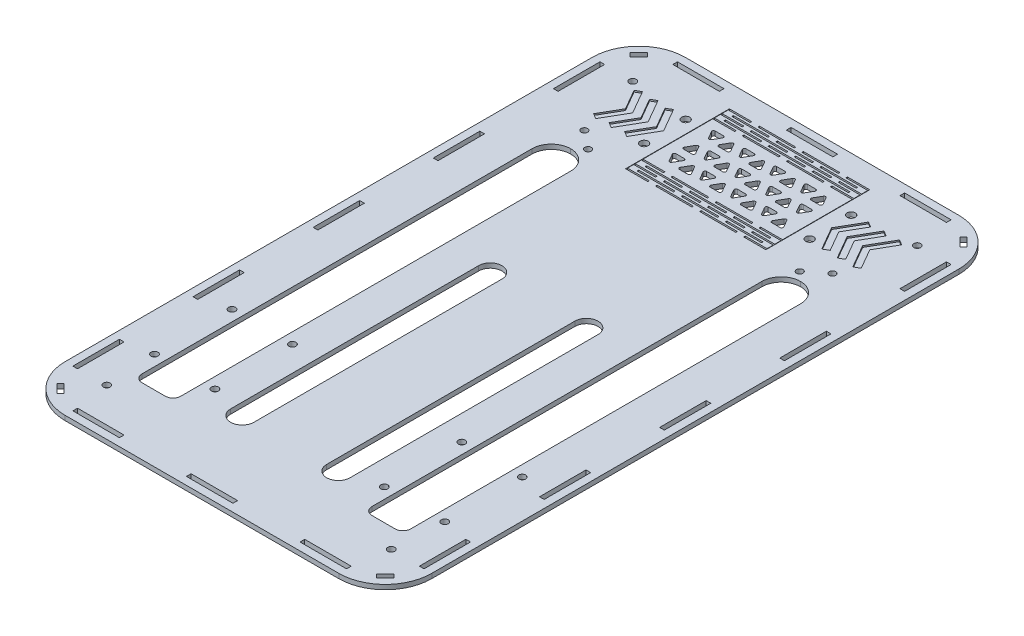
from build123d import *

# Parameters (mm, degrees)
SKETCH1_W           = 236.5
SKETCH1_H           = 400
BOSS_EXTRUDE1_DEPTH = 1.5
FILLET1_R           = 30
SKETCH2_W           = 3
SKETCH2_H           = 30
CUT_EXTRUDE1_DEPTH  = 233.361921364
SKETCH3_W           = 30
SKETCH3_H           = 3
CUT_EXTRUDE2_DEPTH  = 233.361921364
CUT_EXTRUDE3_DEPTH  = 233.361921364
SKETCH6_W           = 25
SKETCH6_H           = 269
CUT_EXTRUDE4_DEPTH  = 233.361921364
SKETCH8_W           = 0.25
SKETCH8_H           = 67
CUT_EXTRUDE5_DEPTH  = 233.361921364
SKETCH9_W           = 23.416666667
SKETCH9_H           = 1
SKETCH9_W_2         = 23.416666666
SKETCH9_W_3         = 14.083333333
CUT_EXTRUDE6_DEPTH  = 233.361921364
SKETCH7_R           = 2.6
CUT_EXTRUDE7_DEPTH  = 233.361921364
SKETCH10_R          = 2.1
CUT_EXTRUDE8_DEPTH  = 233.361921364
FILLET2_R           = 12.5
FILLET3_R           = 5
SKETCH11_R          = 2.25
CUT_EXTRUDE10_DEPTH = 233.361921364
CUT_EXTRUDE11_DEPTH = 233.361921364
SKETCH13_W          = 80.25
SKETCH13_H          = 1
BOSS_EXTRUDE3_DEPTH = 3
CUT_EXTRUDE12_DEPTH = 233.361921364
FILLET4_R           = 1
SKETCH15_R          = 2.25
CUT_EXTRUDE13_DEPTH = 233.361921364
CUT_EXTRUDE14_DEPTH = 1


with BuildPart() as part:
    # Sketch1 → Boss-Extrude1 (new, symmetric)
    with BuildSketch(Plane(origin=(0, 0, 0), x_dir=(1, 0, 0), z_dir=(0, 1, 0))):
        Rectangle(SKETCH1_W, SKETCH1_H)
    extrude(amount=BOSS_EXTRUDE1_DEPTH, both=True)

    # Fillet1
    fillet1_edges = [part.edges().sort_by_distance(p)[0] for p in [
        (118.25, 0, 200),
        (-118.25, 0, 200),
        (-118.25, 0, -200),
        (118.25, 0, -200),
    ]]
    fillet(fillet1_edges, radius=FILLET1_R)

    # Sketch2 → Cut-Extrude1 (cut, through all)
    with BuildSketch(Plane(origin=(0, 1.5, 0), x_dir=(1, 0, 0), z_dir=(0, 1, 0))):
        with Locations((-111.75, -155)):
            Rectangle(SKETCH2_W, SKETCH2_H)
        with Locations((-111.75, -77.5)):
            Rectangle(SKETCH2_W, SKETCH2_H)
        with Locations((-111.75, 0)):
            Rectangle(SKETCH2_W, SKETCH2_H)
        with Locations((-111.75, 77.5)):
            Rectangle(SKETCH2_W, SKETCH2_H)
        with Locations((-111.75, 155)):
            Rectangle(SKETCH2_W, SKETCH2_H)
    cut_extrude1 = extrude(amount=-CUT_EXTRUDE1_DEPTH, mode=Mode.SUBTRACT)

    # Sketch3 → Cut-Extrude2 (cut, through all)
    with BuildSketch(Plane(origin=(0, 1.5, 0), x_dir=(1, 0, 0), z_dir=(0, 1, 0))):
        with Locations((-73.25, 193.5)):
            Rectangle(SKETCH3_W, SKETCH3_H)
        with Locations((0, 193.5)):
            Rectangle(SKETCH3_W, SKETCH3_H)
        with Locations((73.25, 193.5)):
            Rectangle(SKETCH3_W, SKETCH3_H)
    cut_extrude2 = extrude(amount=-CUT_EXTRUDE2_DEPTH, mode=Mode.SUBTRACT)

    # Mirror1: Cut-Extrude2 across plane
    add(cut_extrude2.mirror(Plane.XY), mode=Mode.SUBTRACT)

    # Mirror2: Cut-Extrude1 across plane
    add(cut_extrude1.mirror(Plane(origin=(0, 0, 0), x_dir=(0, 0, 1), z_dir=(1, 0, 0))), mode=Mode.SUBTRACT)

    # Sketch4 → Cut-Extrude3 (cut, through all)
    with BuildSketch(Plane(origin=(0, 1.5, 0), x_dir=(1, 0, 0), z_dir=(0, 1, 0))):
        Polygon((-108.756096654, 184.849242405), (-103.099242405, 190.506096654), (-100.718631416, 188.125485666), (-106.375485666, 182.468631416), align=None)
        Polygon((100.718631416, 188.125485666), (106.375485666, 182.468631416), (108.756096654, 184.849242405), (103.099242405, 190.506096654), align=None)
        Polygon((103.099242405, -190.506096654), (100.718631416, -188.125485666), (106.375485666, -182.468631416), (108.756096654, -184.849242405), align=None)
        Polygon((-100.718631416, -188.125485666), (-106.375485666, -182.468631416), (-108.756096654, -184.849242405), (-103.099242405, -190.506096654), align=None)
    extrude(amount=-CUT_EXTRUDE3_DEPTH, mode=Mode.SUBTRACT)

    # Sketch6 → Cut-Extrude4 (cut, through all)
    with BuildSketch(Plane(origin=(0, 1.5, 0), x_dir=(1, 0, 0), z_dir=(0, 1, 0))):
        with Locations((-74.133513652, -22.5)):
            Rectangle(SKETCH6_W, SKETCH6_H)
        with Locations((74.133513652, -22.5)):
            Rectangle(SKETCH6_W, SKETCH6_H)
    extrude(amount=-CUT_EXTRUDE4_DEPTH, mode=Mode.SUBTRACT)

    # Sketch8 → Cut-Extrude5 (cut, through all)
    with BuildSketch(Plane(origin=(0, 1.5, 0), x_dir=(1, 0, 0), z_dir=(0, 1, 0))):
        with Locations((-45.125, 152)):
            Rectangle(SKETCH8_W, SKETCH8_H)
        with Locations((45.125, 152)):
            Rectangle(SKETCH8_W, SKETCH8_H)
    extrude(amount=-CUT_EXTRUDE5_DEPTH, mode=Mode.SUBTRACT)

    # Sketch9 → Cut-Extrude6 (cut, through all)
    with BuildSketch(Plane(origin=(0, 1.5, 0), x_dir=(1, 0, 0), z_dir=(0, 1, 0))):
        with Locations((-28.541666666, 177.5)):
            Rectangle(SKETCH9_W, SKETCH9_H)
        with Locations((-28.541666666, 172.5)):
            Rectangle(SKETCH9_W, SKETCH9_H)
        with Locations((-0.125, 172.5)):
            Rectangle(SKETCH9_W_2, SKETCH9_H)
        with Locations((28.291666666, 172.5)):
            Rectangle(SKETCH9_W, SKETCH9_H)
        with Locations((-14.208333334, 175)):
            Rectangle(SKETCH9_W, SKETCH9_H)
        with Locations((14.208333334, 175)):
            Rectangle(SKETCH9_W, SKETCH9_H)
        with Locations((37.958333334, 175)):
            Rectangle(SKETCH9_W_3, SKETCH9_H)
        with Locations((-37.958333334, 175)):
            Rectangle(SKETCH9_W_3, SKETCH9_H)
        with Locations((-0.125, 177.5)):
            Rectangle(SKETCH9_W_2, SKETCH9_H)
        with Locations((28.291666666, 177.5)):
            Rectangle(SKETCH9_W, SKETCH9_H)
        with Locations((-14.208333334, 180)):
            Rectangle(SKETCH9_W, SKETCH9_H)
        with Locations((14.208333334, 180)):
            Rectangle(SKETCH9_W, SKETCH9_H)
        with Locations((37.958333334, 180)):
            Rectangle(SKETCH9_W_3, SKETCH9_H)
        with Locations((-37.958333334, 180)):
            Rectangle(SKETCH9_W_3, SKETCH9_H)
        with Locations((-28.541666666, 182.5)):
            Rectangle(SKETCH9_W, SKETCH9_H)
        with Locations((-0.125, 182.5)):
            Rectangle(SKETCH9_W_2, SKETCH9_H)
        with Locations((28.291666666, 182.5)):
            Rectangle(SKETCH9_W, SKETCH9_H)
        with Locations((-14.208333334, 185)):
            Rectangle(SKETCH9_W, SKETCH9_H)
        with Locations((14.208333334, 185)):
            Rectangle(SKETCH9_W, SKETCH9_H)
        with Locations((37.958333334, 185)):
            Rectangle(SKETCH9_W_3, SKETCH9_H)
        with Locations((-37.958333334, 185)):
            Rectangle(SKETCH9_W_3, SKETCH9_H)
    cut_extrude6 = extrude(amount=-CUT_EXTRUDE6_DEPTH, mode=Mode.SUBTRACT)

    # Sketch7 → Cut-Extrude7 (cut, through all)
    with BuildSketch(Plane(origin=(0, 1.5, 0), x_dir=(1, 0, 0), z_dir=(0, 1, 0))):
        with Locations(Location((-53.4, 165.4, 0), (0, 0, 270))):
            Circle(SKETCH7_R)
        with Locations(Location((-53.4, 138.6, 0), (0, 0, 270))):
            Circle(SKETCH7_R)
        with Locations(Location((53.4, 138.6, 0), (0, 0, 270))):
            Circle(SKETCH7_R)
        with Locations(Location((53.4, 165.4, 0), (0, 0, 270))):
            Circle(SKETCH7_R)
    extrude(amount=-CUT_EXTRUDE7_DEPTH, mode=Mode.SUBTRACT)

    # Mirror3: Cut-Extrude6 across plane
    add(cut_extrude6.mirror(Plane(origin=(0, 0, -152), x_dir=(1, 0, 0), z_dir=(0, 0, -1))), mode=Mode.SUBTRACT)

    # Sketch10 → Cut-Extrude8 (cut, through all)
    with BuildSketch(Plane(origin=(0, 1.5, 0), x_dir=(1, 0, 0), z_dir=(0, 1, 0))):
        with Locations(Location((68.276997582, 117.314787143, 0), (0, 0, 270))):
            Circle(SKETCH10_R)
        with Locations(Location((79.990029723, 126.685212857, 0), (0, 0, 270))):
            Circle(SKETCH10_R)
        with Locations(Location((-79.990029723, 126.685212857, 0), (0, 0, 90))):
            Circle(SKETCH10_R)
        with Locations(Location((-68.276997582, 117.314787143, 0), (0, 0, 90))):
            Circle(SKETCH10_R)
    extrude(amount=-CUT_EXTRUDE8_DEPTH, mode=Mode.SUBTRACT)

    # Fillet2
    fillet2_edges = [part.edges().sort_by_distance(p)[0] for p in [
        (-61.633513652, 0, -112),
        (-86.633513652, 0, -112),
        (61.633513652, 0, -112),
        (86.633513652, 0, -112),
    ]]
    fillet(fillet2_edges, radius=FILLET2_R - 0.0001)  # a hair under: the kernel refuses the full size

    # Fillet3
    fillet3_edges = [part.edges().sort_by_distance(p)[0] for p in [
        (-61.633513652, 0, 157),
        (-86.633513652, 0, 157),
        (86.633513652, 0, 157),
        (61.633513652, 0, 157),
    ]]
    fillet(fillet3_edges, radius=FILLET3_R)

    # Sketch11 → Cut-Extrude10 (cut, through all)
    with BuildSketch(Plane(origin=(0, 1.5, 0), x_dir=(1, 0, 0), z_dir=(0, 1, 0))):
        with Locations(Location((91.75, 169.666666667, 0), (0, 0, 270))):
            Circle(SKETCH11_R)
        with Locations(Location((-91.75, 169.666666667, 0), (0, 0, 90))):
            Circle(SKETCH11_R)
        with Locations(Location((91.75, -169.666666667, 0), (0, 0, 90))):
            Circle(SKETCH11_R)
        with Locations(Location((-91.75, -169.666666667, 0), (0, 0, 270))):
            Circle(SKETCH11_R)
    extrude(amount=-CUT_EXTRUDE10_DEPTH, mode=Mode.SUBTRACT)

    # Sketch12 → Cut-Extrude11 (cut, through all)
    with BuildSketch(Plane(origin=(0, 1.5, 0), x_dir=(1, 0, 0), z_dir=(0, 1, 0))):
        with BuildLine():
            Line((-23.500513652, 17), (-23.500513652, -143))
            ThreePointArc((-23.500513652, -143), (-31.000513652, -150.5), (-38.500513652, -143))
            Line((-38.500513652, -143), (-38.500513652, 17))
            ThreePointArc((-38.500513652, 17), (-31.000513652, 24.5), (-23.500513652, 17))
        make_face()
        with BuildLine():
            Line((23.500513652, 17), (23.500513652, -143))
            ThreePointArc((23.500513652, -143), (31.000513652, -150.5), (38.500513652, -143))
            Line((38.500513652, -143), (38.500513652, 17))
            ThreePointArc((38.500513652, 17), (31.000513652, 24.5), (23.500513652, 17))
        make_face()
    extrude(amount=-CUT_EXTRUDE11_DEPTH, mode=Mode.SUBTRACT)

    # Sketch13 → Boss-Extrude3 (add, through all)
    with BuildSketch(Plane(origin=(0, 1.5, 0), x_dir=(1, 0, 0), z_dir=(0, 1, 0))):
        with Locations((-0.125, 172.5)):
            Rectangle(SKETCH13_W, SKETCH13_H)
        with Locations((-0.125, 131.5)):
            Rectangle(SKETCH13_W, SKETCH13_H)
    extrude(amount=-BOSS_EXTRUDE3_DEPTH)

    # Sketch14 → Cut-Extrude12 (cut, through all)
    with BuildSketch(Plane(origin=(0, 1.5, 0), x_dir=(1, 0, 0), z_dir=(0, 1, 0))):
        Polygon((-39.168584287, 168.5), (-34.742232223, 160.833333333), (-30.315880159, 168.5), align=None)
        Polygon((-34.742232223, 155.833333333), (-39.168584287, 148.166666667), (-30.315880159, 148.166666667), align=None)
        Polygon((-39.168584287, 143.166666667), (-34.742232223, 135.5), (-30.315880159, 143.166666667), align=None)
        Polygon((-24.815880159, 143.166666667), (-29.242232223, 135.5), (-20.389528096, 135.5), align=None)
        Polygon((-20.389528096, 155.833333333), (-29.242232223, 155.833333333), (-24.815880159, 148.166666667), align=None)
        Polygon((-24.815880159, 168.5), (-29.242232223, 160.833333333), (-20.389528096, 160.833333333), align=None)
        Polygon((-19.315880159, 168.5), (-14.889528096, 160.833333333), (-10.463176032, 168.5), align=None)
        Polygon((-14.889528096, 155.833333333), (-19.315880159, 148.166666667), (-10.463176032, 148.166666667), align=None)
        Polygon((-19.315880159, 143.166666667), (-14.889528096, 135.5), (-10.463176032, 143.166666667), align=None)
        Polygon((-4.963176032, 143.166666667), (-9.389528096, 135.5), (-0.536823968, 135.5), align=None)
        Polygon((-0.536823968, 155.833333333), (-9.389528096, 155.833333333), (-4.963176032, 148.166666667), align=None)
        Polygon((-4.963176032, 168.5), (-9.389528096, 160.833333333), (-0.536823968, 160.833333333), align=None)
        Polygon((0.536823968, 168.5), (4.963176032, 160.833333333), (9.389528096, 168.5), align=None)
        Polygon((4.963176032, 155.833333333), (0.536823968, 148.166666667), (9.389528096, 148.166666667), align=None)
        Polygon((0.536823968, 143.166666667), (4.963176032, 135.5), (9.389528096, 143.166666667), align=None)
        Polygon((14.889528096, 143.166666667), (10.463176032, 135.5), (19.315880159, 135.5), align=None)
        Polygon((19.315880159, 155.833333333), (10.463176032, 155.833333333), (14.889528096, 148.166666667), align=None)
        Polygon((14.889528096, 168.5), (10.463176032, 160.833333333), (19.315880159, 160.833333333), align=None)
        Polygon((20.389528096, 168.5), (24.815880159, 160.833333333), (29.242232223, 168.5), align=None)
        Polygon((24.815880159, 155.833333333), (20.389528096, 148.166666667), (29.242232223, 148.166666667), align=None)
        Polygon((20.389528096, 143.166666667), (24.815880159, 135.5), (29.242232223, 143.166666667), align=None)
        Polygon((34.742232223, 143.166666667), (30.315880159, 135.5), (39.168584287, 135.5), align=None)
        Polygon((39.168584287, 155.833333333), (30.315880159, 155.833333333), (34.742232223, 148.166666667), align=None)
        Polygon((34.742232223, 168.5), (30.315880159, 160.833333333), (39.168584287, 160.833333333), align=None)
    extrude(amount=-CUT_EXTRUDE12_DEPTH, mode=Mode.SUBTRACT)

    # Fillet4
    fillet4_edges = [part.edges().sort_by_distance(p)[0] for p in [
        (0.536823968, 0, -168.5),
        (9.389528096, 0, -168.5),
        (4.963176032, 0, -160.833333333),
        (-4.963176032, 0, -168.5),
        (-0.536823968, 0, -160.833333333),
        (-9.389528096, 0, -160.833333333),
        (-4.963176032, 0, -148.166666667),
        (-9.389528096, 0, -155.833333333),
        (-0.536823968, 0, -155.833333333),
        (-24.815880159, 0, -168.5),
        (-20.389528096, 0, -160.833333333),
        (-29.242232223, 0, -160.833333333),
        (4.963176032, 0, -155.833333333),
        (9.389528096, 0, -148.166666667),
        (0.536823968, 0, -148.166666667),
        (0.536823968, 0, -143.166666667),
        (9.389528096, 0, -143.166666667),
        (4.963176032, 0, -135.5),
        (14.889528096, 0, -143.166666667),
        (19.315880159, 0, -135.5),
        (10.463176032, 0, -135.5),
        (14.889528096, 0, -148.166666667),
        (10.463176032, 0, -155.833333333),
        (19.315880159, 0, -155.833333333),
        (-4.963176032, 0, -143.166666667),
        (-0.536823968, 0, -135.5),
        (-9.389528096, 0, -135.5),
        (-19.315880159, 0, -143.166666667),
        (-10.463176032, 0, -143.166666667),
        (-14.889528096, 0, -135.5),
        (-14.889528096, 0, -155.833333333),
        (-10.463176032, 0, -148.166666667),
        (-19.315880159, 0, -148.166666667),
        (-19.315880159, 0, -168.5),
        (-10.463176032, 0, -168.5),
        (-14.889528096, 0, -160.833333333),
        (-24.815880159, 0, -148.166666667),
        (-29.242232223, 0, -155.833333333),
        (-20.389528096, 0, -155.833333333),
        (-24.815880159, 0, -143.166666667),
        (-20.389528096, 0, -135.5),
        (-29.242232223, 0, -135.5),
        (-39.168584287, 0, -143.166666667),
        (-30.315880159, 0, -143.166666667),
        (-34.742232223, 0, -135.5),
        (-34.742232223, 0, -155.833333333),
        (-30.315880159, 0, -148.166666667),
        (-39.168584287, 0, -148.166666667),
        (14.889528096, 0, -168.5),
        (19.315880159, 0, -160.833333333),
        (10.463176032, 0, -160.833333333),
        (20.389528096, 0, -168.5),
        (29.242232223, 0, -168.5),
        (24.815880159, 0, -160.833333333),
        (24.815880159, 0, -155.833333333),
        (29.242232223, 0, -148.166666667),
        (20.389528096, 0, -148.166666667),
        (20.389528096, 0, -143.166666667),
        (29.242232223, 0, -143.166666667),
        (24.815880159, 0, -135.5),
        (34.742232223, 0, -143.166666667),
        (39.168584287, 0, -135.5),
        (30.315880159, 0, -135.5),
        (34.742232223, 0, -148.166666667),
        (30.315880159, 0, -155.833333333),
        (39.168584287, 0, -155.833333333),
        (34.742232223, 0, -168.5),
        (39.168584287, 0, -160.833333333),
        (30.315880159, 0, -160.833333333),
        (-39.168584287, 0, -168.5),
        (-30.315880159, 0, -168.5),
        (-34.742232223, 0, -160.833333333),
    ]]
    fillet(fillet4_edges, radius=FILLET4_R)

    # Sketch15 → Cut-Extrude13 (cut, through all)
    with BuildSketch(Plane(origin=(0, 1.5, 0), x_dir=(1, 0, 0), z_dir=(0, 1, 0))):
        with Locations(Location((-54.633513652, -87, 0), (0, 0, 270))):
            Circle(SKETCH15_R)
        with Locations(Location((-93.633513652, -87, 0), (0, 0, 270))):
            Circle(SKETCH15_R)
        with Locations(Location((-93.633513652, -137, 0), (0, 0, 270))):
            Circle(SKETCH15_R)
        with Locations(Location((-54.633513652, -137, 0), (0, 0, 270))):
            Circle(SKETCH15_R)
    cut_extrude13 = extrude(amount=-CUT_EXTRUDE13_DEPTH, mode=Mode.SUBTRACT)

    # Sketch16 → Cut-Extrude14 (cut)
    with BuildSketch(Plane(origin=(0, 1.5, 0), x_dir=(1, 0, 0), z_dir=(0, 1, 0))):
        Polygon((-62.873652079, 167.067605548), (-54.17436596, 152), (-62.873652079, 136.932394452), (-66.337753694, 138.932394452), (-58.793168113, 152), (-66.337753694, 165.067605548), align=None)
        Polygon((-72.873652079, 167.067605548), (-64.17436596, 152), (-72.873652079, 136.932394452), (-76.337753694, 138.932394452), (-68.793168113, 152), (-76.337753694, 165.067605548), align=None)
        Polygon((-82.873652079, 167.067605548), (-74.17436596, 152), (-82.873652079, 136.932394452), (-86.337753694, 138.932394452), (-78.793168113, 152), (-86.337753694, 165.067605548), align=None)
    cut_extrude14 = extrude(amount=-CUT_EXTRUDE14_DEPTH, mode=Mode.SUBTRACT)

    # Mirror4: Cut-Extrude13, Cut-Extrude14 across plane
    add(cut_extrude13.mirror(Plane(origin=(0, 0, 0), x_dir=(0, 0, 1), z_dir=(1, 0, 0))), mode=Mode.SUBTRACT)
    add(cut_extrude14.mirror(Plane(origin=(0, 0, 0), x_dir=(0, 0, 1), z_dir=(1, 0, 0))), mode=Mode.SUBTRACT)


solid = part.part
